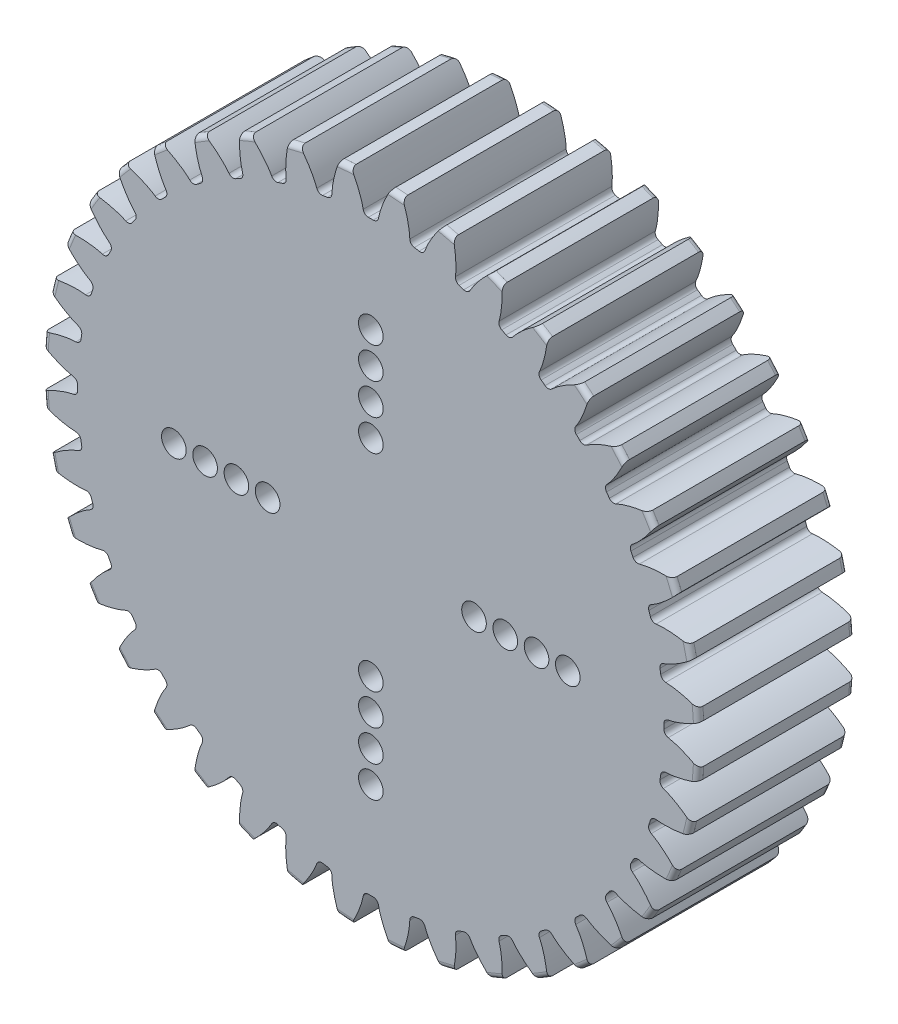
from build123d import *

# Parameters (mm, degrees)
BOSS_EXTRUDE1_DEPTH      = 12.7
BOSS_EXTRUDE1_DEPTH_BACK = 12.7
SKETCH3_R                = 26.67
SKETCH5_W                = 12.7
SKETCH5_H                = 4.826
SKETCH5_W_2              = 25.4
SKETCH5_H_2              = 6.35
FILLET2_R                = 0.426091396
CUT_EXTRUDE1_DEPTH       = 40.797836791
FILLET1_R                = 0.426091396
CIRPATTERN1_COUNT        = 40
FILLET1_OF_CIRPATTERN1_R = 0.426091396
SKETCH6_R                = 37.222013668
CUT_EXTRUDE2_DEPTH       = 12.7
SKETCH7_R                = 13.329903745
BOSS_EXTRUDE2_DEPTH      = 12.7
CUT_EXTRUDE3_REACH       = 41.733
SKETCH9_R                = 0.999998


with BuildPart() as part:
    # Sketch3 → Boss-Extrude1 (new, two sides: drawn at the far end of the back side and taken through both)
    with BuildSketch(Plane.XY.offset(-BOSS_EXTRUDE1_DEPTH_BACK)):
        Circle(SKETCH3_R)
    extrude(amount=BOSS_EXTRUDE1_DEPTH + BOSS_EXTRUDE1_DEPTH_BACK)

    # Sketch5 → Cut-Revolve1 (revolve, cut)
    with BuildSketch(Plane(origin=(0, 0, 0), x_dir=(0, 0, -1), z_dir=(1, 0, 0)), mode=Mode.PRIVATE) as cut_revolve1_sk:
        with Locations((-6.35, 24.257)):
            Rectangle(SKETCH5_W, SKETCH5_H)
        with Locations((0, 3.175)):
            Rectangle(SKETCH5_W_2, SKETCH5_H_2)
    revolve(cut_revolve1_sk.sketch.rotate(Axis((0, 0, 12.7), (0, 0, -1)), 90), axis=Axis((0, 0, 12.7), (0, 0, -1)), mode=Mode.SUBTRACT)

    # Fillet2
    fillet2_edges = [part.edges().sort_by_distance(p)[0] for p in [
        (-6.35, 0, 12.7),
        (-6.35, 0, -12.7),
        (-21.844, 0, 12.7),
        (-21.844, 0, 0),
        (-26.67, 0, 0),
        (-26.67, 0, -12.7),
    ]]
    fillet(fillet2_edges, radius=FILLET2_R)

    # Sketch4 → Cut-Extrude1 (cut, symmetric)
    with BuildSketch(Plane.XY):
        with BuildLine():
            Line((23.805431862, 0.58014664), (23.861107899, 0.581503484))
            add(Edge.make_bspline(
                [(23.861107899, 0.581503484), (23.865491394, 0.581656584), (23.877782006, 0.582229225), (23.901001525, 0.583877498), (23.938862615, 0.587370548), (23.98705952, 0.593002454), (24.049296811, 0.601638249), (24.122530739, 0.613556165), (24.202917072, 0.628481684), (24.290260257, 0.646693102), (24.377288642, 0.666606389), (24.463993984, 0.688094976), (24.550261373, 0.710965729), (24.65462588, 0.740400625), (24.779577858, 0.778101916), (24.925325839, 0.825674511), (25.090251782, 0.88376555), (25.257910771, 0.947393641), (25.422524397, 1.013638057), (25.588399373, 1.084747707), (25.748575087, 1.156510249), (25.914462046, 1.235329419), (26.067337555, 1.310259595), (26.238045397, 1.398944077), (26.375644023, 1.471895525), (26.51728997, 1.551202577), (26.586156499, 1.590384455), (26.621320267, 1.610654285)],
                knots=[0, 0, 0, 0, 0, 0.005376749, 0.015083688, 0.02853182, 0.04661014, 0.064854849, 0.092110526, 0.119476176, 0.146842496, 0.174208854, 0.201574956, 0.228941013, 0.256307345, 0.307035032, 0.361767352, 0.416499661, 0.471231937, 0.525964282, 0.580696616, 0.635428982, 0.690161387, 0.744893688, 0.799626082, 0.854358407, 0.909090914, 0.909090914, 0.909090914, 0.909090914, 0.909090914], degree=4))
            ThreePointArc((26.621320267, 1.610654285), (26.67, 0), (26.621320267, -1.610654285))
            add(Edge.make_bspline(
                [(23.861107899, -0.581503484), (23.865491394, -0.581656584), (23.877782006, -0.582229225), (23.901001525, -0.583877498), (23.938862615, -0.587370548), (23.98705952, -0.593002454), (24.049296811, -0.601638249), (24.122530739, -0.613556165), (24.202917072, -0.628481684), (24.290260257, -0.646693102), (24.377288642, -0.666606389), (24.463993984, -0.688094976), (24.550261373, -0.710965729), (24.65462588, -0.740400625), (24.779577858, -0.778101916), (24.925325839, -0.825674511), (25.090251782, -0.88376555), (25.257910771, -0.947393641), (25.422524397, -1.013638057), (25.588399373, -1.084747707), (25.748575087, -1.156510249), (25.914462046, -1.235329419), (26.067337555, -1.310259595), (26.238045397, -1.398944077), (26.375644023, -1.471895525), (26.51728997, -1.551202577), (26.586156499, -1.590384455), (26.621320267, -1.610654285)],
                knots=[0, 0, 0, 0, 0, 0.005376749, 0.015083688, 0.02853182, 0.04661014, 0.064854849, 0.092110526, 0.119476176, 0.146842496, 0.174208854, 0.201574956, 0.228941013, 0.256307345, 0.307035032, 0.361767352, 0.416499661, 0.471231937, 0.525964282, 0.580696616, 0.635428982, 0.690161387, 0.744893688, 0.799626082, 0.854358407, 0.909090914, 0.909090914, 0.909090914, 0.909090914, 0.909090914], degree=4))
            Line((23.861107899, -0.581503484), (23.805431862, -0.58014664))
            ThreePointArc((23.805431862, -0.58014664), (23.8125, 0), (23.805431862, 0.58014664))
        make_face()
    cut_extrude1 = extrude(amount=CUT_EXTRUDE1_DEPTH, both=True, mode=Mode.SUBTRACT)

    # Fillet1
    fillet1_edges = [part.edges().sort_by_distance(p)[0] for p in [
        (23.805431862, -0.58014664, -6.35),
        (23.805431862, 0.58014664, -6.35),
    ]]
    fillet(fillet1_edges, radius=FILLET1_R)

    # CirPattern1: Cut-Extrude1 ×40 about axis
    cirpattern1_axis = Axis((0, 0, 12.7), (0, 0, -1))
    for i in range(1, CIRPATTERN1_COUNT):
        add(cut_extrude1.rotate(cirpattern1_axis, i * 360 / CIRPATTERN1_COUNT), mode=Mode.SUBTRACT)

    # Fillet1 of CirPattern1
    fillet1_of_cirpattern1_edges = [part.edges().sort_by_distance(p)[0] for p in [
        (23.421592563, -4.296994071, -6.35),
        (23.603102422, -3.150985926, -6.35),
        (22.461035924, -7.908035246, -6.35),
        (22.819586266, -6.804530761, -6.35),
        (20.947414037, -11.324354349, -6.35),
        (21.474176163, -10.290525466, -6.35),
        (18.917997295, -14.461830264, -6.35),
        (19.600000574, -13.523133282, -6.35),
        (16.422756675, -17.243207922, -6.35),
        (17.243207922, -16.422756675, -6.35),
        (13.523133282, -19.600000574, -6.35),
        (14.461830264, -18.917997295, -6.35),
        (10.290525466, -21.474176163, -6.35),
        (11.324354349, -20.947414037, -6.35),
        (6.804530761, -22.819586266, -6.35),
        (7.908035246, -22.461035924, -6.35),
        (3.150985926, -23.603102422, -6.35),
        (4.296994071, -23.421592563, -6.35),
        (-0.58014664, -23.805431862, -6.35),
        (0.58014664, -23.805431862, -6.35),
        (-4.296994071, -23.421592563, -6.35),
        (-3.150985926, -23.603102422, -6.35),
        (-7.908035246, -22.461035924, -6.35),
        (-6.804530761, -22.819586266, -6.35),
        (-11.324354349, -20.947414037, -6.35),
        (-10.290525466, -21.474176163, -6.35),
        (-14.461830264, -18.917997295, -6.35),
        (-13.523133282, -19.600000574, -6.35),
        (-17.243207922, -16.422756675, -6.35),
        (-16.422756675, -17.243207922, -6.35),
        (-19.600000574, -13.523133282, -6.35),
        (-18.917997295, -14.461830264, -6.35),
        (-21.474176163, -10.290525466, -6.35),
        (-20.947414037, -11.324354349, -6.35),
        (-22.819586266, -6.804530761, -6.35),
        (-22.461035924, -7.908035246, -6.35),
        (-23.603102422, -3.150985926, -6.35),
        (-23.421592563, -4.296994071, -6.35),
        (-23.805431862, 0.58014664, -6.35),
        (-23.805431862, -0.58014664, -6.35),
        (-23.421592563, 4.296994071, -6.35),
        (-23.603102422, 3.150985926, -6.35),
        (-22.461035924, 7.908035246, -6.35),
        (-22.819586266, 6.804530761, -6.35),
        (-20.947414037, 11.324354349, -6.35),
        (-21.474176163, 10.290525466, -6.35),
        (-18.917997295, 14.461830264, -6.35),
        (-19.600000574, 13.523133282, -6.35),
        (-16.422756675, 17.243207922, -6.35),
        (-17.243207922, 16.422756675, -6.35),
        (-13.523133282, 19.600000574, -6.35),
        (-14.461830264, 18.917997295, -6.35),
        (-10.290525466, 21.474176163, -6.35),
        (-11.324354349, 20.947414037, -6.35),
        (-6.804530761, 22.819586266, -6.35),
        (-7.908035246, 22.461035924, -6.35),
        (-3.150985926, 23.603102422, -6.35),
        (-4.296994071, 23.421592563, -6.35),
        (0.58014664, 23.805431862, -6.35),
        (-0.58014664, 23.805431862, -6.35),
        (4.296994071, 23.421592563, -6.35),
        (3.150985926, 23.603102422, -6.35),
        (7.908035246, 22.461035924, -6.35),
        (6.804530761, 22.819586266, -6.35),
        (11.324354349, 20.947414037, -6.35),
        (10.290525466, 21.474176163, -6.35),
        (14.461830264, 18.917997295, -6.35),
        (13.523133282, 19.600000574, -6.35),
        (17.243207922, 16.422756675, -6.35),
        (16.422756675, 17.243207922, -6.35),
        (19.600000574, 13.523133282, -6.35),
        (18.917997295, 14.461830264, -6.35),
        (21.474176163, 10.290525466, -6.35),
        (20.947414037, 11.324354349, -6.35),
        (22.819586266, 6.804530761, -6.35),
        (22.461035924, 7.908035246, -6.35),
        (23.603102422, 3.150985926, -6.35),
        (23.421592563, 4.296994071, -6.35),
    ]]
    fillet(fillet1_of_cirpattern1_edges, radius=FILLET1_OF_CIRPATTERN1_R)

    # Sketch6 → Cut-Extrude2 (cut)
    with BuildSketch(Plane.XY.offset(12.7)):
        Circle(SKETCH6_R)
    extrude(amount=-CUT_EXTRUDE2_DEPTH, mode=Mode.SUBTRACT)

    # Sketch7 → Boss-Extrude2 (add)
    with BuildSketch(Plane.XY):
        Circle(SKETCH7_R)
    extrude(amount=-BOSS_EXTRUDE2_DEPTH)

    # Sketch9 → Cut-Extrude3 (cut, up to next)
    with BuildSketch(Plane(origin=(0, 0, -12.7), x_dir=(-1, 0, 0), z_dir=(0, 0, -1)), mode=Mode.PRIVATE) as cut_extrude3_sk1:
        with Locations((0, 16.002)):
            Circle(SKETCH9_R)
    cut_extrude3_tool1 = extrude(cut_extrude3_sk1.sketch, amount=-CUT_EXTRUDE3_REACH, mode=Mode.PRIVATE) & part.part
    # Sketch9 → Cut-Extrude3 (cut, up to next)
    with BuildSketch(Plane(origin=(0, 0, -12.7), x_dir=(-1, 0, 0), z_dir=(0, 0, -1)), mode=Mode.PRIVATE) as cut_extrude3_sk2:
        with Locations((0, 13.462)):
            Circle(SKETCH9_R)
    cut_extrude3_tool2 = extrude(cut_extrude3_sk2.sketch, amount=-CUT_EXTRUDE3_REACH, mode=Mode.PRIVATE) & part.part
    # Sketch9 → Cut-Extrude3 (cut, up to next)
    with BuildSketch(Plane(origin=(0, 0, -12.7), x_dir=(-1, 0, 0), z_dir=(0, 0, -1)), mode=Mode.PRIVATE) as cut_extrude3_sk3:
        with Locations((0, 10.922)):
            Circle(SKETCH9_R)
    cut_extrude3_tool3 = extrude(cut_extrude3_sk3.sketch, amount=-CUT_EXTRUDE3_REACH, mode=Mode.PRIVATE) & part.part
    # Sketch9 → Cut-Extrude3 (cut, up to next)
    with BuildSketch(Plane(origin=(0, 0, -12.7), x_dir=(-1, 0, 0), z_dir=(0, 0, -1)), mode=Mode.PRIVATE) as cut_extrude3_sk4:
        with Locations((0, 8.382)):
            Circle(SKETCH9_R)
    cut_extrude3_tool4 = extrude(cut_extrude3_sk4.sketch, amount=-CUT_EXTRUDE3_REACH, mode=Mode.PRIVATE) & part.part
    # Sketch9 → Cut-Extrude3 (cut, up to next)
    with BuildSketch(Plane(origin=(0, 0, -12.7), x_dir=(-1, 0, 0), z_dir=(0, 0, -1)), mode=Mode.PRIVATE) as cut_extrude3_sk5:
        with Locations((16.002, 0)):
            Circle(SKETCH9_R)
    cut_extrude3_tool5 = extrude(cut_extrude3_sk5.sketch, amount=-CUT_EXTRUDE3_REACH, mode=Mode.PRIVATE) & part.part
    # Sketch9 → Cut-Extrude3 (cut, up to next)
    with BuildSketch(Plane(origin=(0, 0, -12.7), x_dir=(-1, 0, 0), z_dir=(0, 0, -1)), mode=Mode.PRIVATE) as cut_extrude3_sk6:
        with Locations((13.462, 0)):
            Circle(SKETCH9_R)
    cut_extrude3_tool6 = extrude(cut_extrude3_sk6.sketch, amount=-CUT_EXTRUDE3_REACH, mode=Mode.PRIVATE) & part.part
    # Sketch9 → Cut-Extrude3 (cut, up to next)
    with BuildSketch(Plane(origin=(0, 0, -12.7), x_dir=(-1, 0, 0), z_dir=(0, 0, -1)), mode=Mode.PRIVATE) as cut_extrude3_sk7:
        with Locations((10.922, 0)):
            Circle(SKETCH9_R)
    cut_extrude3_tool7 = extrude(cut_extrude3_sk7.sketch, amount=-CUT_EXTRUDE3_REACH, mode=Mode.PRIVATE) & part.part
    # Sketch9 → Cut-Extrude3 (cut, up to next)
    with BuildSketch(Plane(origin=(0, 0, -12.7), x_dir=(-1, 0, 0), z_dir=(0, 0, -1)), mode=Mode.PRIVATE) as cut_extrude3_sk8:
        with Locations((8.382, 0)):
            Circle(SKETCH9_R)
    cut_extrude3_tool8 = extrude(cut_extrude3_sk8.sketch, amount=-CUT_EXTRUDE3_REACH, mode=Mode.PRIVATE) & part.part
    # Sketch9 → Cut-Extrude3 (cut, up to next)
    with BuildSketch(Plane(origin=(0, 0, -12.7), x_dir=(-1, 0, 0), z_dir=(0, 0, -1)), mode=Mode.PRIVATE) as cut_extrude3_sk9:
        with Locations((0, -16.002)):
            Circle(SKETCH9_R)
    cut_extrude3_tool9 = extrude(cut_extrude3_sk9.sketch, amount=-CUT_EXTRUDE3_REACH, mode=Mode.PRIVATE) & part.part
    # Sketch9 → Cut-Extrude3 (cut, up to next)
    with BuildSketch(Plane(origin=(0, 0, -12.7), x_dir=(-1, 0, 0), z_dir=(0, 0, -1)), mode=Mode.PRIVATE) as cut_extrude3_sk10:
        with Locations((0, -13.462)):
            Circle(SKETCH9_R)
    cut_extrude3_tool10 = extrude(cut_extrude3_sk10.sketch, amount=-CUT_EXTRUDE3_REACH, mode=Mode.PRIVATE) & part.part
    # Sketch9 → Cut-Extrude3 (cut, up to next)
    with BuildSketch(Plane(origin=(0, 0, -12.7), x_dir=(-1, 0, 0), z_dir=(0, 0, -1)), mode=Mode.PRIVATE) as cut_extrude3_sk11:
        with Locations((0, -10.922)):
            Circle(SKETCH9_R)
    cut_extrude3_tool11 = extrude(cut_extrude3_sk11.sketch, amount=-CUT_EXTRUDE3_REACH, mode=Mode.PRIVATE) & part.part
    # Sketch9 → Cut-Extrude3 (cut, up to next)
    with BuildSketch(Plane(origin=(0, 0, -12.7), x_dir=(-1, 0, 0), z_dir=(0, 0, -1)), mode=Mode.PRIVATE) as cut_extrude3_sk12:
        with Locations((0, -8.382)):
            Circle(SKETCH9_R)
    cut_extrude3_tool12 = extrude(cut_extrude3_sk12.sketch, amount=-CUT_EXTRUDE3_REACH, mode=Mode.PRIVATE) & part.part
    # Sketch9 → Cut-Extrude3 (cut, up to next)
    with BuildSketch(Plane(origin=(0, 0, -12.7), x_dir=(-1, 0, 0), z_dir=(0, 0, -1)), mode=Mode.PRIVATE) as cut_extrude3_sk13:
        with Locations((-16.002, 0)):
            Circle(SKETCH9_R)
    cut_extrude3_tool13 = extrude(cut_extrude3_sk13.sketch, amount=-CUT_EXTRUDE3_REACH, mode=Mode.PRIVATE) & part.part
    # Sketch9 → Cut-Extrude3 (cut, up to next)
    with BuildSketch(Plane(origin=(0, 0, -12.7), x_dir=(-1, 0, 0), z_dir=(0, 0, -1)), mode=Mode.PRIVATE) as cut_extrude3_sk14:
        with Locations((-13.462, 0)):
            Circle(SKETCH9_R)
    cut_extrude3_tool14 = extrude(cut_extrude3_sk14.sketch, amount=-CUT_EXTRUDE3_REACH, mode=Mode.PRIVATE) & part.part
    # Sketch9 → Cut-Extrude3 (cut, up to next)
    with BuildSketch(Plane(origin=(0, 0, -12.7), x_dir=(-1, 0, 0), z_dir=(0, 0, -1)), mode=Mode.PRIVATE) as cut_extrude3_sk15:
        with Locations((-10.922, 0)):
            Circle(SKETCH9_R)
    cut_extrude3_tool15 = extrude(cut_extrude3_sk15.sketch, amount=-CUT_EXTRUDE3_REACH, mode=Mode.PRIVATE) & part.part
    # Sketch9 → Cut-Extrude3 (cut, up to next)
    with BuildSketch(Plane(origin=(0, 0, -12.7), x_dir=(-1, 0, 0), z_dir=(0, 0, -1)), mode=Mode.PRIVATE) as cut_extrude3_sk16:
        with Locations((-8.382, 0)):
            Circle(SKETCH9_R)
    cut_extrude3_tool16 = extrude(cut_extrude3_sk16.sketch, amount=-CUT_EXTRUDE3_REACH, mode=Mode.PRIVATE) & part.part
    add(cut_extrude3_tool1.solids().sort_by_distance((0, 16.002, -12.7))[0], mode=Mode.SUBTRACT)
    add(cut_extrude3_tool2.solids().sort_by_distance((0, 13.462, -12.7))[0], mode=Mode.SUBTRACT)
    add(cut_extrude3_tool3.solids().sort_by_distance((0, 10.922, -12.7))[0], mode=Mode.SUBTRACT)
    add(cut_extrude3_tool4.solids().sort_by_distance((0, 8.382, -12.7))[0], mode=Mode.SUBTRACT)
    add(cut_extrude3_tool5.solids().sort_by_distance((-16.002, 0, -12.7))[0], mode=Mode.SUBTRACT)
    add(cut_extrude3_tool6.solids().sort_by_distance((-13.462, 0, -12.7))[0], mode=Mode.SUBTRACT)
    add(cut_extrude3_tool7.solids().sort_by_distance((-10.922, 0, -12.7))[0], mode=Mode.SUBTRACT)
    add(cut_extrude3_tool8.solids().sort_by_distance((-8.382, 0, -12.7))[0], mode=Mode.SUBTRACT)
    add(cut_extrude3_tool9.solids().sort_by_distance((0, -16.002, -12.7))[0], mode=Mode.SUBTRACT)
    add(cut_extrude3_tool10.solids().sort_by_distance((0, -13.462, -12.7))[0], mode=Mode.SUBTRACT)
    add(cut_extrude3_tool11.solids().sort_by_distance((0, -10.922, -12.7))[0], mode=Mode.SUBTRACT)
    add(cut_extrude3_tool12.solids().sort_by_distance((0, -8.382, -12.7))[0], mode=Mode.SUBTRACT)
    add(cut_extrude3_tool13.solids().sort_by_distance((16.002, 0, -12.7))[0], mode=Mode.SUBTRACT)
    add(cut_extrude3_tool14.solids().sort_by_distance((13.462, 0, -12.7))[0], mode=Mode.SUBTRACT)
    add(cut_extrude3_tool15.solids().sort_by_distance((10.922, 0, -12.7))[0], mode=Mode.SUBTRACT)
    add(cut_extrude3_tool16.solids().sort_by_distance((8.382, 0, -12.7))[0], mode=Mode.SUBTRACT)


solid = part.part
